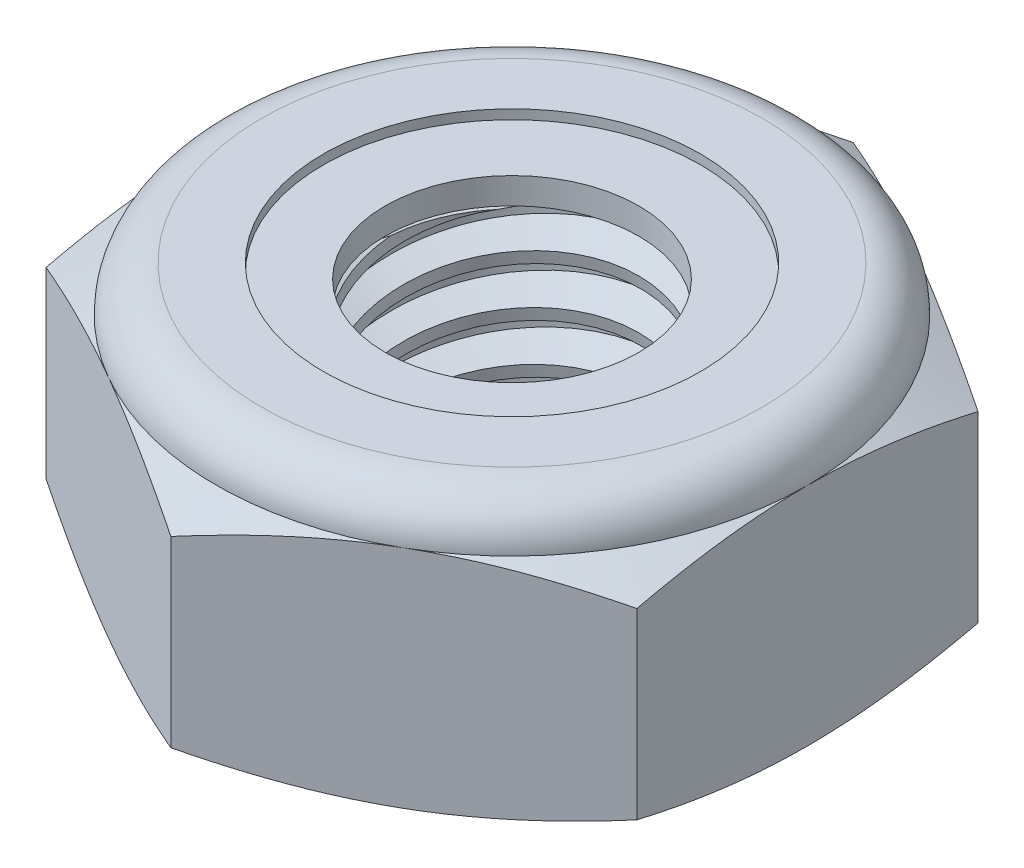
from build123d import *

# Parameters (mm, degrees)
EXTRUDE1_DEPTH       = 4.365625
SKETCH2_W            = 2.413
SKETCH2_H            = 4.365625
LPATTERN1_COUNT      = 6
LPATTERN1_PITCH      = 0.79375
LPATTERN1_COUNT_DIR2 = 2
LPATTERN1_PITCH_DIR2 = 0.79375


with BuildPart() as part:
    # Sketch1 → Extrude1 (new body)
    with BuildSketch(Plane(origin=(0, 0, 0), x_dir=(1, 0, 0), z_dir=(0, 1, 0))):
        Polygon((0, 5.499261314), (-4.7625, 2.749630657), (-4.7625, -2.749630657), (0, -5.499261314), (4.7625, -2.749630657), (4.7625, 2.749630657), align=None)
    extrude(amount=EXTRUDE1_DEPTH)

    # Sketch4 → Cut-Revolve2 (revolve, cut)
    with BuildSketch(Plane(origin=(0, 0, 0), x_dir=(0, 0, -1), z_dir=(1, 0, 0))):
        Polygon((0, 4.365625), (2.413, 4.365625), (2.045424837, 4.194221887), (2.045424837, 0.171403113), (2.413, 0), (0, 0), align=None)
    revolve(axis=Axis((0, 4.365625, 0), (0, 1, 0)), mode=Mode.SUBTRACT)


with BuildPart() as body_2:
    # Sketch2 → Revolve1 (revolve)
    with BuildSketch(Plane(origin=(0, 0, 0), x_dir=(0, 0, -1), z_dir=(1, 0, 0))):
        with Locations((1.2065, 2.1828125)):
            Rectangle(SKETCH2_W, SKETCH2_H)
    revolve(axis=Axis((0, -2.413, 0), (0, 1, 0)))

    # Sketch3 → Cut-Revolve1 (revolve, cut)
    with BuildSketch(Plane(origin=(0, 0, 0), x_dir=(0, 0, -1), z_dir=(1, 0, 0))):
        Polygon((2.429102527, 4.267721635), (2.541820218, 3.582398076), (2.077629892, 3.757430502), (2.045424837, 3.953237233), align=None)
    cut_revolve1 = revolve(axis=Axis((0, 4.365625, 0.139697061), (0, -0.9867425810390564, -0.1622931876708976)), mode=Mode.SUBTRACT)

    # LPattern1: Cut-Revolve1 6 × 2
    with Locations(*[Vector(0, -1, 0) * (i * LPATTERN1_PITCH) + Vector(0, 1, 0) * (j * LPATTERN1_PITCH_DIR2) for i in range(LPATTERN1_COUNT) for j in range(LPATTERN1_COUNT_DIR2) if (i, j) != (0, 0)]):
        add(cut_revolve1, mode=Mode.SUBTRACT)


with BuildPart() as part_1:
    add(part.part)

    # Combine1: cut body 2
    add(body_2.part, mode=Mode.SUBTRACT)

    # Sketch5 → Cut-Revolve3 (revolve, cut)
    with BuildSketch(Plane(origin=(0, 0, 0), x_dir=(0, 0, -1), z_dir=(1, 0, 0))):
        with BuildLine():
            Line((0, 0), (4.7625, 0))
            Line((4.7625, 0), (5.499261314, 0.343557443))
            Line((5.499261314, 0.343557443), (5.499261314, 3.29446339))
            Line((5.499261314, 3.29446339), (4.7625, 3.638020833))
            ThreePointArc((4.7625, 3.638020833), (4.549389674, 4.152514674), (4.034895833, 4.365625))
            Line((4.034895833, 4.365625), (4.034895833, 5.635625))
            Line((4.034895833, 5.635625), (6.769261314, 5.635625))
            Line((6.769261314, 5.635625), (6.769261314, -1.27))
            Line((6.769261314, -1.27), (0, -1.27))
            Line((0, -1.27), (0, 0))
        make_face()
    revolve(axis=Axis((0, 0, 0), (0, 1, 0)), mode=Mode.SUBTRACT)

    # Sketch6 → Cut-Revolve4 (revolve, cut)
    with BuildSketch(Plane(origin=(0, 0, 0), x_dir=(0, 0, -1), z_dir=(1, 0, 0))):
        with BuildLine():
            Line((0, 3.638020833), (4.6101, 3.638020833))
            ThreePointArc((4.6101, 3.638020833), (4.4416266, 4.0447516), (4.034895833, 4.213225))
            Line((4.034895833, 4.213225), (3.040160335, 4.213225))
            Line((3.040160335, 4.213225), (3.040160335, 5.635625))
            Line((3.040160335, 5.635625), (0, 5.635625))
            Line((0, 5.635625), (0, 3.638020833))
        make_face()
    revolve(axis=Axis((0, 5.635625, 0), (0, 1, 0)), mode=Mode.SUBTRACT)


with BuildPart() as body_2_2:
    # Sketch7 → Revolve2 (revolve)
    with BuildSketch(Plane(origin=(0, 0, 0), x_dir=(0, 0, -1), z_dir=(1, 0, 0))):
        with BuildLine():
            Line((2.045424837, 3.714220833), (4.528047654, 3.714220833))
            ThreePointArc((4.528047654, 3.714220833), (4.359688876, 4.016854092), (4.034895833, 4.137025))
            Line((4.034895833, 4.137025), (2.045424837, 4.137025))
            Line((2.045424837, 4.137025), (2.045424837, 3.714220833))
        make_face()
    revolve(axis=Axis((0, 3.714220833, 0), (0, 1, 0)))


solid = Compound([part_1.part, body_2_2.part])
